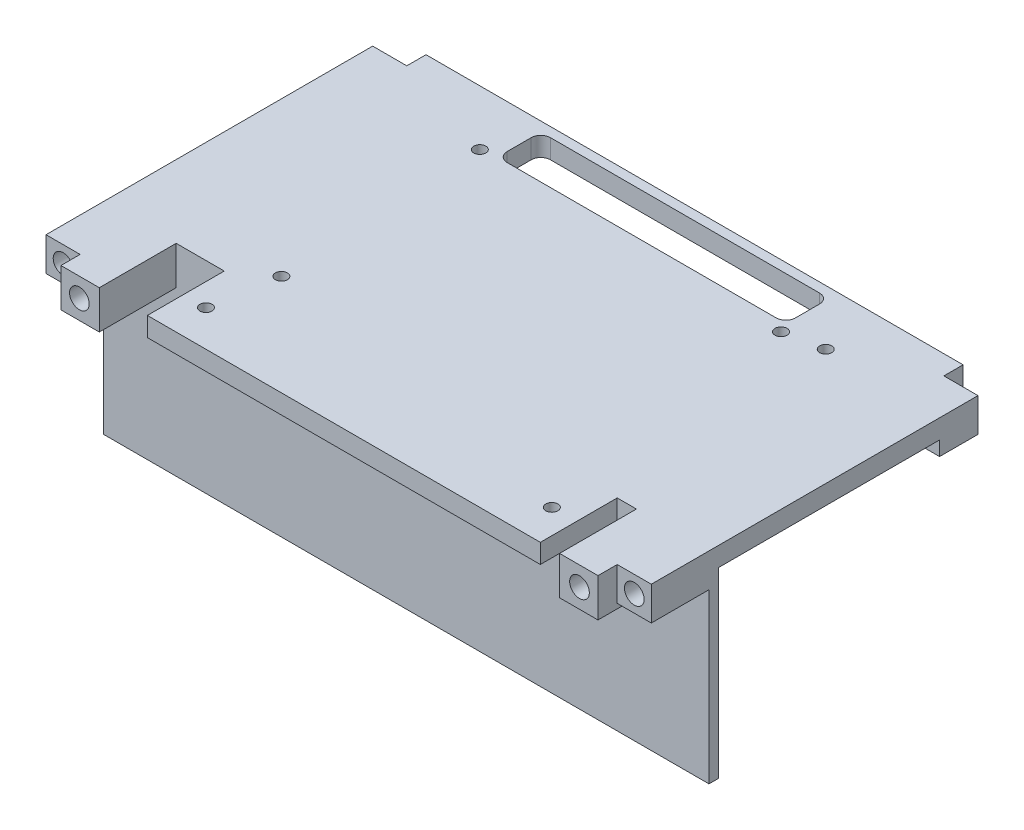
from build123d import *

# Parameters (mm, degrees)
BOSS_EXTRUDE1_DEPTH             = 4
SKETCH3_W                       = 7.1
SKETCH3_H                       = 8
BOSS_EXTRUDE3_DEPTH             = 3
SKETCH4_R                       = 2.05
CUT_EXTRUDE1_DEPTH              = 7
MIRROR2_COPY_1_SKETCH_W         = 7.1
MIRROR2_COPY_1_SKETCH_H         = 8
MIRROR2_COPY_1_DEPTH            = 3
MIRROR2_COPY_2_SKETCH_R         = 2.05
MIRROR2_COPY_2_DEPTH            = 7
SKETCH5_W                       = 60
SKETCH5_H                       = 9
CUT_EXTRUDE2_DEPTH              = 76.4917214
FILLET1_R                       = 2
SKETCH7_W                       = 111.8
SKETCH7_H                       = 1
CUT_EXTRUDE3_DEPTH              = 76.4917214
SKETCH8_W                       = 126
SKETCH8_H                       = 2
BOSS_EXTRUDE4_DEPTH             = 38
SKETCH9_W                       = 12
SKETCH9_H                       = 18
CUT_EXTRUDE4_DEPTH              = 10
SKETCH10_W                      = 7.1
SKETCH10_H                      = 4
BOSS_EXTRUDE5_DEPTH             = 3
SKETCH12_W                      = 1.5
SKETCH12_H                      = 4
BOSS_EXTRUDE6_DEPTH             = 2
SKETCH13_W                      = 40
SKETCH13_H                      = 2
BOSS_EXTRUDE7_DEPTH             = 38
SKETCH14_W                      = 1.5
SKETCH14_H                      = 4
BOSS_EXTRUDE8_DEPTH             = 1
BOSS_EXTRUDE9_REACH             = 85.744
BOSS_EXTRUDE9_DIRECTION_2_REACH = 85.744
SKETCH16_W                      = 20
SKETCH16_H                      = 14
SKETCH16_W_2                    = 14.5
SKETCH16_H_2                    = 9
BOSS_EXTRUDE10_DEPTH            = 4
SKETCH17_W                      = 12
SKETCH17_H                      = 18
CUT_EXTRUDE5_DEPTH              = 84.743656476
SKETCH18_W                      = 6
SKETCH18_H                      = 6
CUT_EXTRUDE6_DEPTH              = 86.632937588
SKETCH22_R                      = 1.25
CUT_EXTRUDE7_DEPTH              = 4
SKETCH25_W                      = 6
SKETCH25_H                      = 38
CUT_EXTRUDE11_DEPTH             = 10
CUT_EXTRUDE12_DEPTH             = 85.498520697
CUT_EXTRUDE12_DEPTH_BACK        = 85.498520697
SKETCH26_W                      = 7.701552738
SKETCH26_H                      = 30.562488548
SKETCH26_W_2                    = 6.53419365
SKETCH26_H_2                    = 28.524331859
SKETCH27_R                      = 1.25
CUT_EXTRUDE13_DEPTH             = 86.632937588
SKETCH28_W                      = 99.8
SKETCH28_H                      = 0.6
SKETCH28_W_2                    = 87.8
CUT_EXTRUDE14_DEPTH             = 86.632937588
SKETCH29_W                      = 87.8
SKETCH29_H                      = 1.4
CUT_EXTRUDE15_DEPTH             = 86.354320336
SKETCH30_W                      = 99.8
SKETCH30_H                      = 1.4
CUT_EXTRUDE16_DEPTH             = 86.354320336
SKETCH31_W                      = 2
SKETCH31_H                      = 4
CUT_EXTRUDE17_DEPTH             = 85.717176535
BOSS_EXTRUDE11_START            = -12
SKETCH32_W                      = 8
SKETCH32_H                      = 8
BOSS_EXTRUDE11_DEPTH            = 12
SKETCH33_R                      = 2.05
CUT_EXTRUDE18_DEPTH             = 10
MIRROR5_START                   = -26
MIRROR5_OUTLINE_W               = 8
MIRROR5_OUTLINE_H               = 8
MIRROR5_OUTLINE_R               = 2.05
MIRROR5_DEPTH                   = 64
MIRROR5_2_OUTLINE_R             = 2.05
MIRROR5_2_DEPTH                 = 54
SKETCH34_W                      = 6
SKETCH34_H                      = 16
CUT_EXTRUDE19_DEPTH             = 10
SKETCH35_W                      = 8
SKETCH35_H                      = 46
CUT_EXTRUDE20_DEPTH             = 4
SKETCH36_W                      = 14
SKETCH36_H                      = 6
BOSS_EXTRUDE12_DEPTH            = 1
SKETCH38_W                      = 14
SKETCH38_H                      = 6
BOSS_EXTRUDE13_DEPTH            = 3
CHAMFER1_SIZE                   = 1
SKETCH37_R                      = 1.6
CUT_EXTRUDE21_DEPTH             = 6
CHAMFER2_SIZE                   = 3
SKETCH39_W                      = 20
SKETCH39_H                      = 14
CUT_EXTRUDE22_DEPTH             = 16


# Read off the part's stored shape, not the designer's step: Mirror5
with BuildPart() as part:
    # Sketch1 → Boss-Extrude1 (new body)
    with BuildSketch(Plane(origin=(0, 0, 0), x_dir=(1, 0, 0), z_dir=(0, 1, 0))):
        Polygon((-63, -34), (-55.9, -34), (-55.9, -41), (55.9, -41), (55.9, -34), (63, -34), (63, 34), (55.9, 34), (55.9, 41), (-55.9, 41), (-55.9, 34), (-63, 34), align=None)
    extrude(amount=BOSS_EXTRUDE1_DEPTH)

    # Sketch3 → Boss-Extrude3 (add)
    with BuildSketch(Plane.XZ):
        with Locations((-59.45, -30)):
            Rectangle(SKETCH3_W, SKETCH3_H)
    boss_extrude3 = extrude(amount=BOSS_EXTRUDE3_DEPTH)

    # Sketch4 → Cut-Extrude1 (cut)
    with BuildSketch(Plane(origin=(0, 0, -34), x_dir=(-1, 0, 0), z_dir=(0, 0, -1))):
        with Locations((59.45, 0.5)):
            Circle(SKETCH4_R)
    cut_extrude1 = extrude(amount=-CUT_EXTRUDE1_DEPTH, mode=Mode.SUBTRACT)

    # Mirror1: Boss-Extrude3, Cut-Extrude1 across plane
    add(boss_extrude3.mirror(Plane(origin=(0, 0, 0), x_dir=(0, 0, 1), z_dir=(1, 0, 0))))
    add(cut_extrude1.mirror(Plane(origin=(0, 0, 0), x_dir=(0, 0, 1), z_dir=(1, 0, 0))), mode=Mode.SUBTRACT)

    # Mirror2: Boss-Extrude3, Cut-Extrude1 across plane
    add(boss_extrude3.mirror(Plane.XY))
    add(cut_extrude1.mirror(Plane.XY), mode=Mode.SUBTRACT)

    # Mirror2 copy 1 sketch → Mirror2 copy 1 (add)
    with BuildSketch(Plane(origin=(0, 0, 0), x_dir=(-1, 0, 0), z_dir=(0, -1, 0))):
        with Locations((-59.45, -30)):
            Rectangle(MIRROR2_COPY_1_SKETCH_W, MIRROR2_COPY_1_SKETCH_H)
    extrude(amount=MIRROR2_COPY_1_DEPTH)

    # Mirror2 copy 2 sketch → Mirror2 copy 2 (cut)
    with BuildSketch(Plane.XY.offset(34)):
        with Locations((59.45, 0.5)):
            Circle(MIRROR2_COPY_2_SKETCH_R)
    extrude(amount=-MIRROR2_COPY_2_DEPTH, mode=Mode.SUBTRACT)

    # Sketch5 → Cut-Extrude2 (cut, through all)
    with BuildSketch(Plane(origin=(0, 4, 0), x_dir=(1, 0, 0), z_dir=(0, 1, 0))):
        with Locations((0, 31.5)):
            Rectangle(SKETCH5_W, SKETCH5_H)
    extrude(amount=-CUT_EXTRUDE2_DEPTH, mode=Mode.SUBTRACT)

    # Fillet1
    fillet1_edges = [part.edges().sort_by_distance(p)[0] for p in [
        (-30, 2, -27),
        (-30, 2, -36),
        (30, 2, -36),
        (30, 2, -27),
    ]]
    fillet(fillet1_edges, radius=FILLET1_R)

    # Sketch7 → Cut-Extrude3 (cut, through all)
    with BuildSketch(Plane(origin=(0, 4, 0), x_dir=(1, 0, 0), z_dir=(0, 1, 0))):
        with Locations((0, 40.5)):
            Rectangle(SKETCH7_W, SKETCH7_H)
        with Locations((0, -40.5)):
            Rectangle(SKETCH7_W, SKETCH7_H)
    extrude(amount=-CUT_EXTRUDE3_DEPTH, mode=Mode.SUBTRACT)

    # Sketch8 → Boss-Extrude4 (add)
    with BuildSketch(Plane.XZ):
        with Locations((0, 21)):
            Rectangle(SKETCH8_W, SKETCH8_H)
    extrude(amount=BOSS_EXTRUDE4_DEPTH)

    # Sketch9 → Cut-Extrude4 (cut)
    with BuildSketch(Plane(origin=(0, 4, 0), x_dir=(1, 0, 0), z_dir=(0, 1, 0))):
        with Locations((-49.9, -31)):
            Rectangle(SKETCH9_W, SKETCH9_H)
    extrude(amount=-CUT_EXTRUDE4_DEPTH, mode=Mode.SUBTRACT)

    # Sketch10 → Boss-Extrude5 (add)
    with BuildSketch(Plane.XZ.offset(3)):
        with Locations((-59.45, 24)):
            Rectangle(SKETCH10_W, SKETCH10_H)
        with Locations((59.45, 24)):
            Rectangle(SKETCH10_W, SKETCH10_H)
    extrude(amount=-BOSS_EXTRUDE5_DEPTH)

    # Sketch12 → Boss-Extrude6 (add)
    # profile 1 of 2: a face of its own
    with BuildSketch(Plane.ZY.offset(56)):
        Polygon((22, -5.8), (22, -16.2), (24.7, -13.5), (24.7, -8.5), align=None)
        with Locations((23.35, -11)):
            Rectangle(SKETCH12_W, SKETCH12_H, mode=Mode.SUBTRACT)
    # profile 2 of 2: a face of its own
    with BuildSketch(Plane.ZY.offset(56)):
        Polygon((22, -20.8), (22, -31.2), (24.7, -28.5), (24.7, -23.5), align=None)
        with Locations((23.35, -26)):
            Rectangle(SKETCH12_W, SKETCH12_H, mode=Mode.SUBTRACT)
    boss_extrude6 = extrude(amount=-BOSS_EXTRUDE6_DEPTH)

    # Mirror3: Boss-Extrude6 across plane
    add(boss_extrude6.mirror(Plane(origin=(-49.9, 0, 0), x_dir=(0, 0, 1), z_dir=(1, 0, 0))))

    # Sketch13 → Boss-Extrude7 (add)
    with BuildSketch(Plane.XZ):
        with Locations((0, -18.5)):
            Rectangle(SKETCH13_W, SKETCH13_H)
    extrude(amount=BOSS_EXTRUDE7_DEPTH)

    # Sketch14 → Boss-Extrude8 (add, symmetric)
    # profile 1 of 2: a face of its own
    with BuildSketch(Plane(origin=(0, 0, 0), x_dir=(0, 0, -1), z_dir=(1, 0, 0))):
        Polygon((22.2, -8.5), (19.5, -5.8), (19.5, -16.2), (22.2, -13.5), align=None)
        with Locations((20.85, -11)):
            Rectangle(SKETCH14_W, SKETCH14_H, mode=Mode.SUBTRACT)
    # profile 2 of 2: a face of its own
    with BuildSketch(Plane(origin=(0, 0, 0), x_dir=(0, 0, -1), z_dir=(1, 0, 0))):
        Polygon((22.2, -28.5), (22.2, -23.5), (19.5, -20.8), (19.5, -31.2), align=None)
        with Locations((20.85, -26)):
            Rectangle(SKETCH14_W, SKETCH14_H, mode=Mode.SUBTRACT)
    extrude(amount=BOSS_EXTRUDE8_DEPTH, both=True)

    # Boss-Extrude9: up to this face of the body (flat: up to its plane)
    boss_extrude9_end = Plane(part.part.faces().sort_by_distance((-20, -19, -18.5))[0])
    # Sketch15 → Boss-Extrude9 (add, up to the picked face)
    with BuildSketch(Plane(origin=(0, 0, 0), x_dir=(0, 0, -1), z_dir=(1, 0, 0)), mode=Mode.PRIVATE) as boss_extrude9_sk1:
        Polygon((17.5, 0), (17.5, -5), (14.613248654, 0), align=None)
    boss_extrude9_tool1 = split(extrude(boss_extrude9_sk1.sketch, amount=-BOSS_EXTRUDE9_REACH, mode=Mode.PRIVATE), bisect_by=boss_extrude9_end, keep=Keep.BOTH, mode=Mode.PRIVATE)
    add(boss_extrude9_tool1.solids().sort_by(Axis((0, -1.666667, -16.53775), (-1, 0, 0)))[0])

    # Boss-Extrude9 direction 2: up to this face of the body (flat: up to its plane)
    boss_extrude9_direction_2_end = Plane(part.part.faces().sort_by_distance((20, -19, -18.5))[0])
    # Sketch15 → Boss-Extrude9 direction 2 (add, up to the picked face)
    with BuildSketch(Plane(origin=(0, 0, 0), x_dir=(0, 0, -1), z_dir=(1, 0, 0)), mode=Mode.PRIVATE) as boss_extrude9_direction_2_sk1:
        Polygon((17.5, 0), (17.5, -5), (14.613248654, 0), align=None)
    boss_extrude9_direction_2_tool1 = split(extrude(boss_extrude9_direction_2_sk1.sketch, amount=BOSS_EXTRUDE9_DIRECTION_2_REACH, mode=Mode.PRIVATE), bisect_by=boss_extrude9_direction_2_end, keep=Keep.BOTH, mode=Mode.PRIVATE)
    add(boss_extrude9_direction_2_tool1.solids().sort_by(Axis((0, -1.666667, -16.53775), (1, 0, 0)))[0])

    # Sketch16 → Boss-Extrude10 (add)
    with BuildSketch(Plane.XY.offset(40)):
        with Locations((30, -7)):
            Rectangle(SKETCH16_W, SKETCH16_H)
        with Locations((30, -7)):
            Rectangle(SKETCH16_W_2, SKETCH16_H_2, mode=Mode.SUBTRACT)
    extrude(amount=-BOSS_EXTRUDE10_DEPTH)

    # Sketch17 → Cut-Extrude5 (cut, through all)
    with BuildSketch(Plane.XZ):
        with Locations((49.9, 31)):
            Rectangle(SKETCH17_W, SKETCH17_H)
    extrude(amount=-CUT_EXTRUDE5_DEPTH, mode=Mode.SUBTRACT)

    # Sketch18 → Cut-Extrude6 (cut, through all)
    with BuildSketch(Plane(origin=(0, 4, 0), x_dir=(1, 0, 0), z_dir=(0, 1, 0))):
        with Locations((52.9, 37)):
            Rectangle(SKETCH18_W, SKETCH18_H)
        with Locations((-52.9, 37)):
            Rectangle(SKETCH18_W, SKETCH18_H)
    extrude(amount=-CUT_EXTRUDE6_DEPTH, mode=Mode.SUBTRACT)

    # Sketch22 → Cut-Extrude7 (cut)
    with BuildSketch(Plane(origin=(0, 4, 0), x_dir=(1, 0, 0), z_dir=(0, 1, 0))):
        with Locations(Location((31, 25, 0), (0, 0, 270))):
            Circle(SKETCH22_R)
        with Locations(Location((-31, -17, 0), (0, 0, 270))):
            Circle(SKETCH22_R)
    extrude(amount=-CUT_EXTRUDE7_DEPTH, mode=Mode.SUBTRACT)

    # Sketch25 → Cut-Extrude11 (cut)
    with BuildSketch(Plane(origin=(0, 0, -19.5), x_dir=(-1, 0, 0), z_dir=(0, 0, -1))):
        with Locations((-17, -19)):
            Rectangle(SKETCH25_W, SKETCH25_H)
        with Locations((17, -19)):
            Rectangle(SKETCH25_W, SKETCH25_H)
    extrude(amount=-CUT_EXTRUDE11_DEPTH, mode=Mode.SUBTRACT)

    # Sketch26 → Cut-Extrude12 (cut, two sides: drawn at the far end of the back side and taken through both)
    with BuildSketch(Plane.ZY.offset(1).offset(-CUT_EXTRUDE12_DEPTH_BACK)):
        with Locations((-23.350776369, -21.081244274)):
            Rectangle(SKETCH26_W, SKETCH26_H)
        with Locations((25.267096825, -20.06216593)):
            Rectangle(SKETCH26_W_2, SKETCH26_H_2)
    extrude(amount=CUT_EXTRUDE12_DEPTH + CUT_EXTRUDE12_DEPTH_BACK, mode=Mode.SUBTRACT)

    # Sketch27 → Cut-Extrude13 (cut, through all)
    with BuildSketch(Plane(origin=(0, 4, 0), x_dir=(1, 0, 0), z_dir=(0, 1, 0))):
        with Locations(Location((-33.2, 26.5, 0), (0, 0, 270))):
            Circle(SKETCH27_R)
        with Locations(Location((-33.2, -30.5, 0), (0, 0, 270))):
            Circle(SKETCH27_R)
        with Locations(Location((38.8, -30.5, 0), (0, 0, 270))):
            Circle(SKETCH27_R)
        with Locations(Location((38.8, 26.5, 0), (0, 0, 270))):
            Circle(SKETCH27_R)
    extrude(amount=-CUT_EXTRUDE13_DEPTH, mode=Mode.SUBTRACT)

    # Sketch28 → Cut-Extrude14 (cut, through all)
    with BuildSketch(Plane(origin=(0, 4, 0), x_dir=(1, 0, 0), z_dir=(0, 1, 0))):
        with Locations((0, 39.7)):
            Rectangle(SKETCH28_W, SKETCH28_H)
        with Locations((0, -39.7)):
            Rectangle(SKETCH28_W_2, SKETCH28_H)
    extrude(amount=-CUT_EXTRUDE14_DEPTH, mode=Mode.SUBTRACT)

    # Sketch29 → Cut-Extrude15 (cut, through all)
    with BuildSketch(Plane(origin=(0, 4, 0), x_dir=(1, 0, 0), z_dir=(0, 1, 0))):
        with Locations((0, -38.7)):
            Rectangle(SKETCH29_W, SKETCH29_H)
    extrude(amount=-CUT_EXTRUDE15_DEPTH, mode=Mode.SUBTRACT)

    # Sketch30 → Cut-Extrude16 (cut, through all)
    with BuildSketch(Plane(origin=(0, 4, 0), x_dir=(1, 0, 0), z_dir=(0, 1, 0))):
        with Locations((0, 38.7)):
            Rectangle(SKETCH30_W, SKETCH30_H)
    extrude(amount=-CUT_EXTRUDE16_DEPTH, mode=Mode.SUBTRACT)

    # Sketch31 → Cut-Extrude17 (cut, through all)
    with BuildSketch(Plane(origin=(0, 4, 0), x_dir=(1, 0, 0), z_dir=(0, 1, 0))):
        with Locations((-48.9, 36)):
            Rectangle(SKETCH31_W, SKETCH31_H)
        with Locations((48.9, 36)):
            Rectangle(SKETCH31_W, SKETCH31_H)
    extrude(amount=-CUT_EXTRUDE17_DEPTH, mode=Mode.SUBTRACT)

    # Sketch32 → Boss-Extrude11 (add)
    with BuildSketch(Plane(origin=(0, 0, -38), x_dir=(-1, 0, 0), z_dir=(0, 0, -1)).offset(BOSS_EXTRUDE11_START)):
        with Locations((-51.9, 0)):
            Rectangle(SKETCH32_W, SKETCH32_H)
    boss_extrude11 = extrude(amount=BOSS_EXTRUDE11_DEPTH)

    # Sketch33 → Cut-Extrude18 (cut)
    with BuildSketch(Plane(origin=(0, 0, -38), x_dir=(-1, 0, 0), z_dir=(0, 0, -1))):
        with Locations((-52.05, 0)):
            Circle(SKETCH33_R)
    cut_extrude18 = extrude(amount=-CUT_EXTRUDE18_DEPTH, mode=Mode.SUBTRACT)

    # Mirror4: Boss-Extrude11, Cut-Extrude18 across plane
    add(boss_extrude11.mirror(Plane(origin=(0, 0, 0), x_dir=(0, 0, 1), z_dir=(1, 0, 0))))
    add(cut_extrude18.mirror(Plane(origin=(0, 0, 0), x_dir=(0, 0, 1), z_dir=(1, 0, 0))), mode=Mode.SUBTRACT)

    # Mirror5 outline → Mirror5 (add)
    # profile 1 of 2: a face of its own
    with BuildSketch(Plane.XY.offset(MIRROR5_START)):
        with Locations((51.9, 0)):
            Rectangle(MIRROR5_OUTLINE_W, MIRROR5_OUTLINE_H)
        with Locations((52.05, 0)):
            Circle(MIRROR5_OUTLINE_R, mode=Mode.SUBTRACT)
    # profile 2 of 2: a face of its own
    with BuildSketch(Plane.XY.offset(MIRROR5_START)):
        with Locations((-51.9, 0)):
            Rectangle(MIRROR5_OUTLINE_W, MIRROR5_OUTLINE_H)
        with Locations((-52.05, 0)):
            Circle(MIRROR5_OUTLINE_R, mode=Mode.SUBTRACT)
    extrude(amount=MIRROR5_DEPTH)

    # Mirror5 2 outline → Mirror5 2 (add)
    with BuildSketch(Plane.XY.offset(MIRROR5_START)):
        with Locations((52.05, 0)):
            Circle(MIRROR5_2_OUTLINE_R)
        with Locations((-52.05, 0)):
            Circle(MIRROR5_2_OUTLINE_R)
    extrude(amount=MIRROR5_2_DEPTH)

    # Sketch34 → Cut-Extrude19 (cut)
    with BuildSketch(Plane(origin=(0, 4, 0), x_dir=(1, 0, 0), z_dir=(0, 1, 0))):
        with Locations((-40.9, -30)):
            Rectangle(SKETCH34_W, SKETCH34_H)
    extrude(amount=-CUT_EXTRUDE19_DEPTH, mode=Mode.SUBTRACT)

    # Sketch35 → Cut-Extrude20 (cut)
    with BuildSketch(Plane.XZ.offset(4)):
        with Locations((-51.9, -3)):
            Rectangle(SKETCH35_W, SKETCH35_H)
        with Locations((51.9, -3)):
            Rectangle(SKETCH35_W, SKETCH35_H)
    extrude(amount=-CUT_EXTRUDE20_DEPTH, mode=Mode.SUBTRACT)

    # Sketch36 → Boss-Extrude12 (add)
    with BuildSketch(Plane(origin=(0, 0, -19.5), x_dir=(-1, 0, 0), z_dir=(0, 0, -1))):
        with Locations((0, -19)):
            Rectangle(SKETCH36_W, SKETCH36_H)
    extrude(amount=BOSS_EXTRUDE12_DEPTH)

    # Sketch38 → Boss-Extrude13 (add)
    with BuildSketch(Plane.XY.offset(-17.5)):
        with Locations((0, -19)):
            Rectangle(SKETCH38_W, SKETCH38_H)
    extrude(amount=BOSS_EXTRUDE13_DEPTH)

    # Chamfer1
    chamfer1_edges = [part.edges().sort_by_distance(p)[0] for p in [
        (0, -16, -19.5),
    ]]
    chamfer(chamfer1_edges, length=CHAMFER1_SIZE - 0.0001)  # a hair under: the kernel refuses the full size

    # Sketch37 → Cut-Extrude21 (cut)
    with BuildSketch(Plane(origin=(0, 0, -20.5), x_dir=(-1, 0, 0), z_dir=(0, 0, -1))):
        with Locations((-4, -19)):
            Circle(SKETCH37_R)
        with Locations((4, -19)):
            Circle(SKETCH37_R)
    extrude(amount=-CUT_EXTRUDE21_DEPTH, mode=Mode.SUBTRACT)

    # Chamfer2
    chamfer2_edges = [part.edges().sort_by_distance(p)[0] for p in [
        (0, -16, -17.5),
    ]]
    chamfer(chamfer2_edges, length=CHAMFER2_SIZE - 0.0001)  # a hair under: the kernel refuses the full size

    # Sketch39 → Cut-Extrude22 (cut)
    with BuildSketch(Plane.XY.offset(38)):
        with Locations((30, -7)):
            Rectangle(SKETCH39_W, SKETCH39_H)
    extrude(amount=-CUT_EXTRUDE22_DEPTH, mode=Mode.SUBTRACT)


solid = part.part
